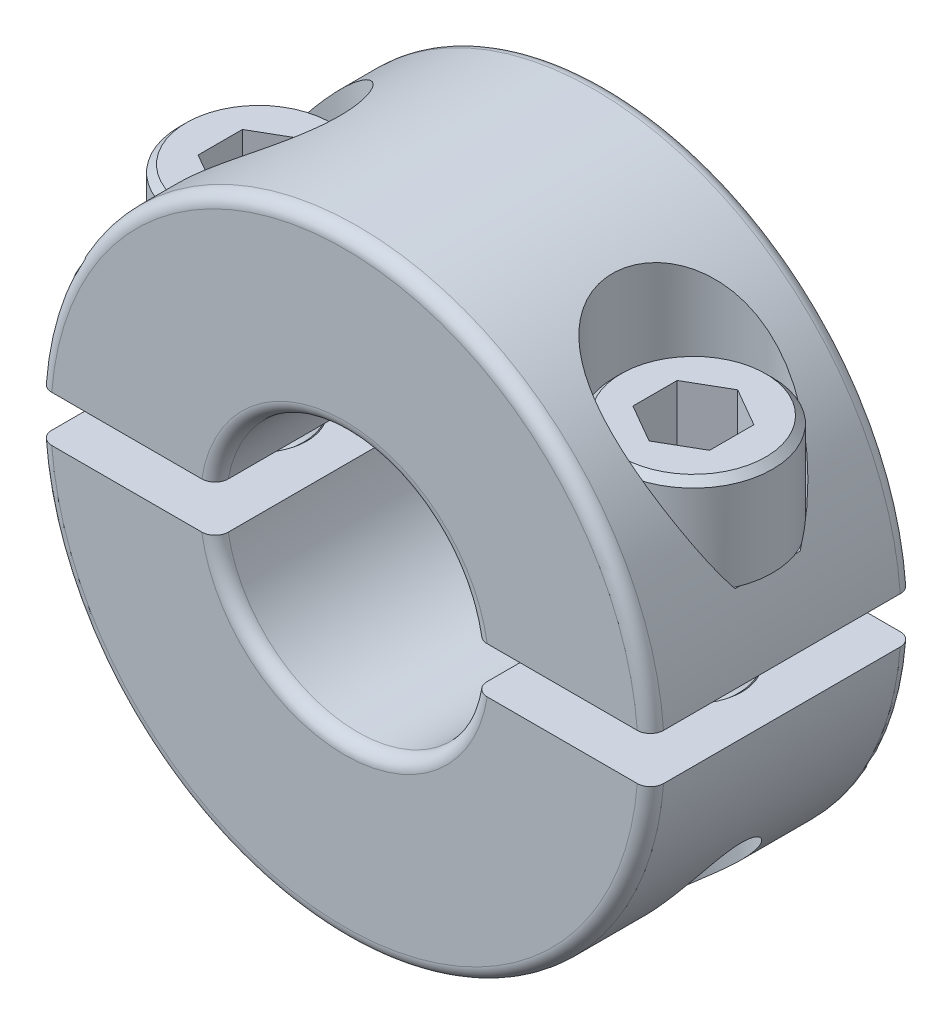
from build123d import *

# Parameters (mm, degrees)
BOSS_EXTRUDE1_DEPTH   = 4.7625
BOSS_EXTRUDE1_2_DEPTH = 4.7625
FILLET1_R             = 0.47625
FILLET2_R             = 0.47625
CUT_EXTRUDE2_DEPTH    = 2.6289
CHAMFER3_SIZE         = 0.5953125
CHAMFER1_SIZE         = 0.254
LPATTERN2_COUNT       = 2
LPATTERN2_PITCH       = 15.748
CUT_SWEEP1_PITCH      = 0.79375
CUT_SWEEP1_TO         = 9.525
LPATTERN1_COUNT       = 2
LPATTERN1_PITCH       = 15.748


with BuildPart() as part:
    # Sketch10 → Boss-Extrude1 (new, symmetric)
    with BuildSketch(Plane.XY):
        with BuildLine():
            Line((-4.689007164, -0.8334375), (-11.081202019, -0.8334375))
            ThreePointArc((-11.081202019, -0.8334375), (0, -11.1125), (11.081202019, -0.8334375))
            Line((11.081202019, -0.8334375), (4.689007164, -0.8334375))
            ThreePointArc((4.689007164, -0.8334375), (0, -4.7625), (-4.689007164, -0.8334375))
        make_face()
    extrude(amount=BOSS_EXTRUDE1_DEPTH, both=True)

    # Fillet2
    fillet2_edges = [part.edges().sort_by_distance(p)[0] for p in [
        (0, -4.7625, 4.7625),
        (0, -11.1125, 4.7625),
        (0, -4.7625, -4.7625),
        (0, -11.1125, -4.7625),
    ]]
    fillet(fillet2_edges, radius=FILLET2_R)


with BuildPart() as body_2:
    # Sketch10 → Boss-Extrude1 2 (new, symmetric)
    with BuildSketch(Plane.XY):
        with BuildLine():
            Line((-11.081202019, 0.8334375), (-4.689007164, 0.8334375))
            ThreePointArc((-4.689007164, 0.8334375), (0, 4.7625), (4.689007164, 0.8334375))
            Line((4.689007164, 0.8334375), (11.081202019, 0.8334375))
            ThreePointArc((11.081202019, 0.8334375), (0, 11.1125), (-11.081202019, 0.8334375))
        make_face()
    extrude(amount=BOSS_EXTRUDE1_2_DEPTH, both=True)

    # Fillet1
    fillet1_edges = [body_2.edges().sort_by_distance(p)[0] for p in [
        (0, 4.7625, 4.7625),
        (0, 11.1125, 4.7625),
        (0, 4.7625, -4.7625),
        (0, 11.1125, -4.7625),
    ]]
    fillet(fillet1_edges, radius=FILLET1_R)


with BuildPart() as cut_revolve1_tool:
    # Sketch2 → Cut-Revolve1 (revolve)
    with BuildSketch(Plane(origin=(0, 0, 0), x_dir=(1, 0, 0), z_dir=(0, 1, 0))):
        with BuildLine():
            Line((-8.128, 4.7625), (-7.747, 4.7625))
            ThreePointArc((-7.747, 4.7625), (-7.9375, 4.572), (-8.128, 4.7625))
        make_face()
    revolve(axis=Axis((0, 0, -4.7625), (0, 0, 1)))


with BuildPart() as part_1:
    add(part.part)

    # Cut-Revolve1: cut by cut_revolve1_tool
    add(cut_revolve1_tool.part, mode=Mode.SUBTRACT)


with BuildPart() as body_2_1:
    add(body_2.part)

    # Cut-Revolve1: cut by cut_revolve1_tool
    add(cut_revolve1_tool.part, mode=Mode.SUBTRACT)


with BuildPart() as cut_revolve2_tool:
    # Sketch3 → Cut-Revolve2 (revolve)
    with BuildSketch(Plane.XY):
        Polygon((-7.874, 11.1125), (-4.9403, 11.1125), (-4.9403, 3.4623375), (-6.1214, 3.4623375), (-6.1214, -11.1125), (-7.874, -11.1125), align=None)
    cut_revolve2 = revolve(axis=Axis((-7.874, -11.1125, 0), (0, 1, 0)))


with BuildPart() as part_2:
    add(part_1.part)

    # Cut-Revolve2: cut by cut_revolve2_tool
    add(cut_revolve2_tool.part, mode=Mode.SUBTRACT)


with BuildPart() as body_2_2:
    add(body_2_1.part)

    # Cut-Revolve2: cut by cut_revolve2_tool
    add(cut_revolve2_tool.part, mode=Mode.SUBTRACT)


with BuildPart() as mirror1_tool:
    # Mirror1: Cut-Revolve2 across plane
    add(cut_revolve2.mirror(Plane(origin=(0, 0, 0), x_dir=(0, 0, 1), z_dir=(1, 0, 0))))


with BuildPart() as part_3:
    add(part_2.part)

    # Mirror1: cut by mirror1_tool
    add(mirror1_tool.part, mode=Mode.SUBTRACT)


with BuildPart() as body_2_3:
    add(body_2_2.part)

    # Mirror1: cut by mirror1_tool
    add(mirror1_tool.part, mode=Mode.SUBTRACT)


with BuildPart() as body_3:
    # Sketch4 → Revolve1 (revolve)
    with BuildSketch(Plane.XY, mode=Mode.PRIVATE) as revolve1_sk:
        Polygon((-7.874, 6.9675375), (-5.0038, 6.9675375), (-5.0038, 3.4623375), (-6.1214, 3.4623375), (-6.1214, -6.0626625), (-7.874, -6.0626625), align=None)
    revolve(revolve1_sk.sketch.rotate(Axis((-7.874, -6.0626625, 0), (0, 1, 0)), 90), axis=Axis((-7.874, -6.0626625, 0), (0, 1, 0)))

    # Sketch5 → Cut-Extrude2 (cut)
    with BuildSketch(Plane(origin=(0, 6.9675375, 0), x_dir=(-1, 0, 0), z_dir=(0, 1, 0))):
        Polygon((7.874, 1.603951217), (6.4849375, 0.801975608), (6.4849375, -0.801975608), (7.874, -1.603951217), (9.2630625, -0.801975608), (9.2630625, 0.801975608), align=None)
    extrude(amount=-CUT_EXTRUDE2_DEPTH, mode=Mode.SUBTRACT)

    # Chamfer3
    chamfer3_edges = [body_3.edges().sort_by_distance(p)[0] for p in [
        (-7.874, -6.0626625, 1.7526),
    ]]
    chamfer(chamfer3_edges, length=CHAMFER3_SIZE)

    # Chamfer1
    chamfer1_edges = [body_3.edges().sort_by_distance(p)[0] for p in [
        (-7.874, 6.9675375, 2.8702),
    ]]
    chamfer(chamfer1_edges, length=CHAMFER1_SIZE)


with BuildPart() as lpattern2_1:
    # LPattern2: pattern copy
    add(body_3.part.moved(Location(Vector(1, 0, 0) * (1 * LPATTERN2_PITCH))))


with BuildPart() as body_3_1:
    add(body_3.part)

    # Cut-Sweep1: arcs per turn and ends read off the stored shape
    # Cut-Sweep1: the profile of Sketch7 screwed along a right-hand helix through 13 turns, 8 arcs to a turn; built about Z, then put on its axis
    cut_sweep1_z = Axis((0, 0, 0), (0, 0, 1))
    cut_sweep1_corners = [(1.237044252, 0, -0.29765625), (1.237044252, 0, -0.396875), (1.795562979, 0, -0.719335937), (1.795562979, 0, 0.024804688)]
    with BuildLine(mode=Mode.PRIVATE) as cut_sweep1_profile:
        Line(cut_sweep1_corners[0], cut_sweep1_corners[1])
        Line(cut_sweep1_corners[1], cut_sweep1_corners[2])
        Line(cut_sweep1_corners[2], cut_sweep1_corners[3])
        Line(cut_sweep1_corners[3], cut_sweep1_corners[0])
    cut_sweep1_cap = Face(cut_sweep1_profile.wire())
    cut_sweep1_turn_angles = [0, 22.5, 45, 67.5, 90, 112.5, 135, 157.5, 180, 202.5, 225, 247.5, 270, 292.5, 315, 337.5, 360]
    cut_sweep1_turn_weights = [1, 0.9238795325112867, 1, 0.9238795325112867, 1, 0.9238795325112867, 1, 0.9238795325112867, 1, 0.9238795325112867, 1, 0.9238795325112867, 1, 0.9238795325112867, 1, 0.9238795325112867, 1]
    cut_sweep1_turn_rails = [Edge.make_bspline([Vector(p[0], p[1], 0).rotate(cut_sweep1_z, cut_sweep1_turn_angles[k]) / cut_sweep1_turn_weights[k] + Vector(0, 0, p[2] + CUT_SWEEP1_PITCH * cut_sweep1_turn_angles[k] / 360) for k in range(17)], [0, 0, 0, 1, 1, 2, 2, 3, 3, 4, 4, 5, 5, 6, 6, 7, 7, 8, 8, 8], 2, cut_sweep1_turn_weights) for p in cut_sweep1_corners]
    cut_sweep1_turn_sides = [Face.make_surface_from_curves(cut_sweep1_turn_rails[p[0]], cut_sweep1_turn_rails[p[1]]) for p in [(0, 1), (1, 2), (2, 3), (3, 0)]]
    cut_sweep1 = Plane(origin=(-7.874, -6.0626625, 0), x_dir=(-1, 0, 0), z_dir=(0, 1, 0)) * split(Solid(Shell([*[p.moved(Location((0, 0, CUT_SWEEP1_PITCH * i))) for i in range(13) for p in cut_sweep1_turn_sides], cut_sweep1_cap, cut_sweep1_cap.rotate(cut_sweep1_z, 4680).moved(Location((0, 0, CUT_SWEEP1_PITCH * 4680 / 360)))])), bisect_by=Plane.XY.offset(CUT_SWEEP1_TO), keep=Keep.BOTTOM, mode=Mode.PRIVATE)
    add(cut_sweep1, mode=Mode.SUBTRACT)


with BuildPart() as lpattern1_1:
    # LPattern1: pattern copy
    add(body_3_1.part.moved(Location(Vector(1, 0, 0) * (1 * LPATTERN1_PITCH))))


solid = Compound([part_3.part, body_2_3.part, body_3_1.part, lpattern1_1.part])
